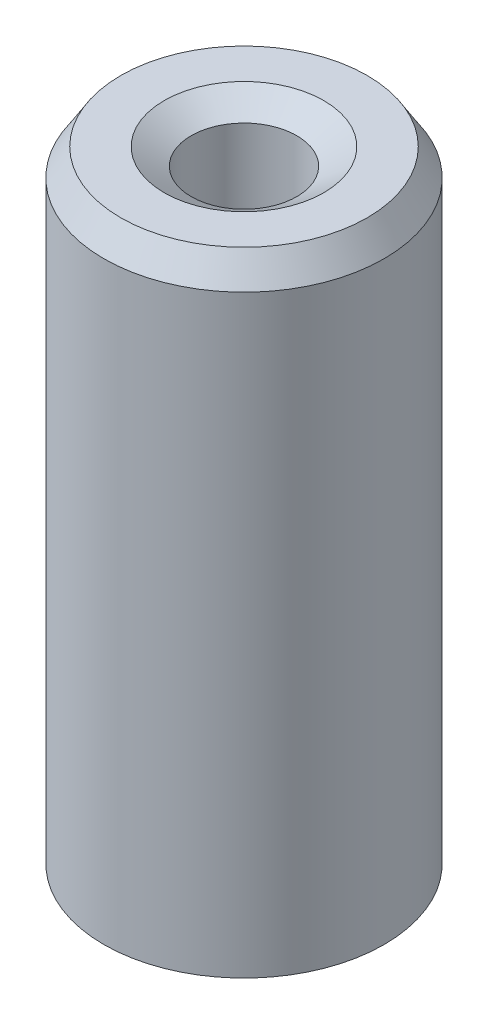
from build123d import *
from OCP.BRepFilletAPI import BRepFilletAPI_MakeChamfer

# Parameters (mm, degrees)
SKETCH1_R           = 12.5
BOSS_EXTRUDE1_DEPTH = 56.89375321
SKETCH2_R           = 4.711508824
CUT_EXTRUDE1_DEPTH  = 60.576834041
CHAMFER1_SIZE       = 2.407389205
CHAMFER1_SIZE2      = 1.508082251


with BuildPart() as part:
    # Sketch1 → Boss-Extrude1 (new body)
    with BuildSketch(Plane(origin=(0, 0, 0), x_dir=(1, 0, 0), z_dir=(0, 1, 0))):
        Circle(SKETCH1_R)
    extrude(amount=BOSS_EXTRUDE1_DEPTH)

    # Sketch2 → Cut-Extrude1 (cut, through all)
    with BuildSketch(Plane(origin=(0, 0, 0), x_dir=(1, 0, 0), z_dir=(0, 1, 0))):
        Circle(SKETCH2_R)
    extrude(amount=CUT_EXTRUDE1_DEPTH, mode=Mode.SUBTRACT)

    # Chamfer1: one chamfer whose edges measure the first distance from different faces: ONE call of the kernel's chamfer builder (chamfer() names one face for all edges)
    chamfer1_edges_1 = [part.edges().sort_by_distance(p)[0] for p in [
        (-4.711508824, 56.89375321, 0),
    ]]
    chamfer1_side_1 = [part.faces().sort_by_distance(p)[0] for p in [
        (-12.146446609, 56.89375321, 0),
    ]]
    chamfer1_edges_2 = [part.edges().sort_by_distance(p)[0] for p in [
        (-4.711508824, 0, 0),
    ]]
    chamfer1_side_2 = [part.faces().sort_by_distance(p)[0] for p in [
        (-4.711508824, 28.446876605, 0),
    ]]
    chamfer1_edges_3 = [part.edges().sort_by_distance(p)[0] for p in [
        (-12.5, 0, 0),
    ]]
    chamfer1_side_3 = [part.faces().sort_by_distance(p)[0] for p in [
        (-12.146446609, 0, 0),
    ]]
    chamfer1_edges_4 = [part.edges().sort_by_distance(p)[0] for p in [
        (-12.5, 56.89375321, 0),
    ]]
    chamfer1_side_4 = [part.faces().sort_by_distance(p)[0] for p in [
        (-12.5, 28.446876605, 0),
    ]]
    chamfer1 = BRepFilletAPI_MakeChamfer(part.part.solid().wrapped)
    for e in chamfer1_edges_1:
        chamfer1.Add(CHAMFER1_SIZE, CHAMFER1_SIZE2, e.wrapped, chamfer1_side_1[0].wrapped)  # the first distance lies on this face
    for e in chamfer1_edges_2:
        chamfer1.Add(CHAMFER1_SIZE, CHAMFER1_SIZE2, e.wrapped, chamfer1_side_2[0].wrapped)  # the first distance lies on this face
    for e in chamfer1_edges_3:
        chamfer1.Add(CHAMFER1_SIZE, CHAMFER1_SIZE2, e.wrapped, chamfer1_side_3[0].wrapped)  # the first distance lies on this face
    for e in chamfer1_edges_4:
        chamfer1.Add(CHAMFER1_SIZE, CHAMFER1_SIZE2, e.wrapped, chamfer1_side_4[0].wrapped)  # the first distance lies on this face
    add(Compound.cast(chamfer1.Shape()), mode=Mode.REPLACE)


solid = part.part
